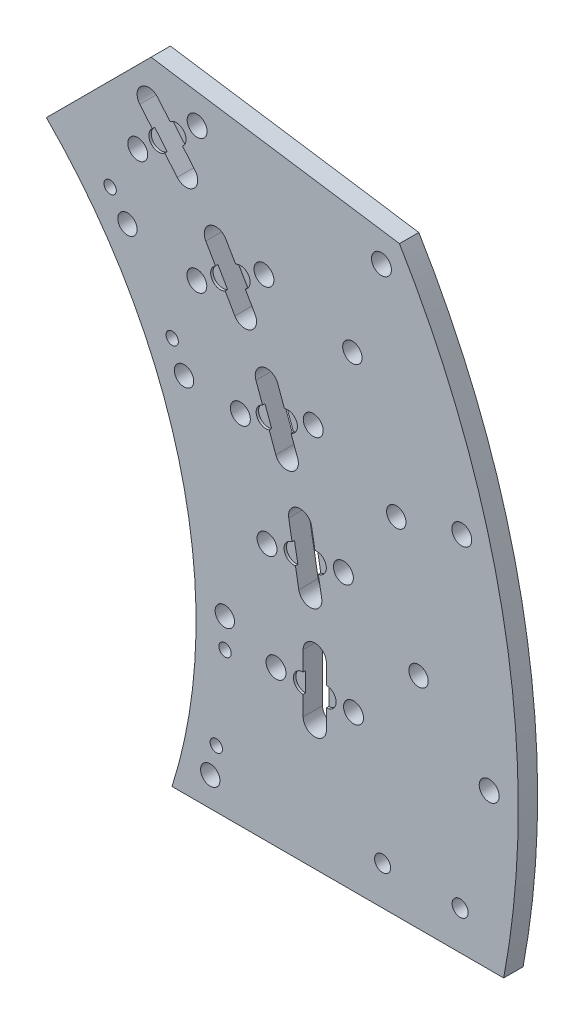
from build123d import *

# Parameters (mm, degrees)
SKETCH1_R           = 3.175
SKETCH1_R_2         = 2.0193
SKETCH1_R_3         = 3.2639
SKETCH1_R_4         = 2.6289
BOSS_EXTRUDE1_DEPTH = 6.35
SKETCH2_R           = 3.175
CUT_EXTRUDE1_DEPTH  = 0.79375


with BuildPart() as part:
    # Sketch1 → Boss-Extrude1 (new body)
    with BuildSketch(Plane.XY):
        with BuildLine():
            ThreePointArc((167.48125, 0), (165.496965553, -25.70454229), (159.591131024, -50.8))
            Line((159.591131024, -50.8), (268.282803213, -50.8))
            ThreePointArc((268.282803213, -50.8), (268.798556268, 47.996235774), (234.123018172, 140.508771477))
            Line((234.123018172, 140.508771477), (152.715190262, 152.715190262))
            Line((152.715190262, 152.715190262), (118.427127597, 118.427127597))
            ThreePointArc((118.427127597, 118.427127597), (154.732498954, 64.092299607), (167.48125, 0))
        make_face()
        with Locations((172.12665951, -41.275)):
            Circle(SKETCH1_R, mode=Mode.SUBTRACT)
        with Locations((174.097718528, -31.956172212)):
            Circle(SKETCH1_R_2, mode=Mode.SUBTRACT)
        with Locations((176.974598028, -3.347266353)):
            Circle(SKETCH1_R_2, mode=Mode.SUBTRACT)
        with Locations((193.675, 0)):
            Circle(SKETCH1_R_3, mode=Mode.SUBTRACT)
        with Locations((176.898422575, 6.177429038)):
            Circle(SKETCH1_R, mode=Mode.SUBTRACT)
        with Locations((190.732641565, 33.63131081)):
            Circle(SKETCH1_R_3, mode=Mode.SUBTRACT)
        with Locations((228.6, -38.1)):
            Circle(SKETCH1_R_4, mode=Mode.SUBTRACT)
        with BuildLine():
            Line((202.565, -9.525), (202.565, 0))
            Line((202.565, 0), (202.565, 9.525))
            ThreePointArc((202.565, 9.525), (206.375, 13.335), (210.185, 9.525))
            Line((210.185, 9.525), (210.185, 0))
            Line((210.185, 0), (210.185, -9.525))
            ThreePointArc((210.185, -9.525), (206.375, -13.335), (202.565, -9.525))
        make_face(mode=Mode.SUBTRACT)
        with Locations((219.075, 0)):
            Circle(SKETCH1_R_3, mode=Mode.SUBTRACT)
        with Locations((254, -38.1)):
            Circle(SKETCH1_R_4, mode=Mode.SUBTRACT)
        with Locations((263.525, 0)):
            Circle(SKETCH1_R_3, mode=Mode.SUBTRACT)
        with BuildLine():
            Line((201.141581381, 25.794749262), (199.487582489, 35.175043109))
            Line((199.487582489, 35.175043109), (197.833583597, 44.555336957))
            ThreePointArc((197.833583597, 44.555336957), (200.924101579, 48.969054052), (205.337818675, 45.87853607))
            Line((205.337818675, 45.87853607), (206.991817567, 36.498242223))
            Line((206.991817567, 36.498242223), (208.645816459, 27.117948375))
            ThreePointArc((208.645816459, 27.117948375), (205.555298477, 22.70423128), (201.141581381, 25.794749262))
        make_face(mode=Mode.SUBTRACT)
        with Locations((215.746758491, 38.041974522)):
            Circle(SKETCH1_R_3, mode=Mode.SUBTRACT)
        with Locations((240.38178065, 21.030680725)):
            Circle(SKETCH1_R, mode=Mode.SUBTRACT)
        with Locations((144.995031539, 101.526614087)):
            Circle(SKETCH1_R, mode=Mode.SUBTRACT)
        with Locations((163.532451502, 67.7373593)):
            Circle(SKETCH1_R, mode=Mode.SUBTRACT)
        with Locations((181.994968331, 66.240751259)):
            Circle(SKETCH1_R_3, mode=Mode.SUBTRACT)
        with BuildLine():
            Line((193.606577595, 60.33073812), (190.348835729, 69.281310333))
            Line((190.348835729, 69.281310333), (187.091093864, 78.231882546))
            ThreePointArc((187.091093864, 78.231882546), (189.368226003, 83.115208177), (194.251551635, 80.838076038))
            Line((194.251551635, 80.838076038), (197.5092935, 71.887503825))
            Line((197.5092935, 71.887503825), (200.767035365, 62.936931612))
            ThreePointArc((200.767035365, 62.936931612), (198.489903226, 58.053605981), (193.606577595, 60.33073812))
        make_face(mode=Mode.SUBTRACT)
        with Locations((159.651941396, 76.436052669)):
            Circle(SKETCH1_R_2, mode=Mode.SUBTRACT)
        with Locations((167.727470078, 96.8375)):
            Circle(SKETCH1_R_3, mode=Mode.SUBTRACT)
        with Locations((139.323763183, 109.179217581)):
            Circle(SKETCH1_R_2, mode=Mode.SUBTRACT)
        with Locations((148.363657521, 124.491890306)):
            Circle(SKETCH1_R_3, mode=Mode.SUBTRACT)
        with BuildLine():
            Line((180.188935918, 93.033608029), (175.426435918, 101.2825))
            Line((175.426435918, 101.2825), (170.663935918, 109.531391971))
            ThreePointArc((170.663935918, 109.531391971), (172.058492706, 114.735948759), (177.263049494, 113.341391971))
            Line((177.263049494, 113.341391971), (182.025549494, 105.0925))
            Line((182.025549494, 105.0925), (186.788049494, 96.843608029))
            ThreePointArc((186.788049494, 96.843608029), (185.393492706, 91.639051241), (180.188935918, 93.033608029))
        make_face(mode=Mode.SUBTRACT)
        with Locations((189.724515334, 109.5375)):
            Circle(SKETCH1_R_3, mode=Mode.SUBTRACT)
        with BuildLine():
            Line((161.296344603, 122.909698835), (155.17379262, 130.206272156))
            Line((155.17379262, 130.206272156), (149.051240638, 137.502845477))
            ThreePointArc((149.051240638, 137.502845477), (149.520849174, 142.870495598), (154.888499295, 142.400887063))
            Line((154.888499295, 142.400887063), (161.011051277, 135.104313742))
            Line((161.011051277, 135.104313742), (167.133603259, 127.807740421))
            ThreePointArc((167.133603259, 127.807740421), (166.663994724, 122.4400903), (161.296344603, 122.909698835))
        make_face(mode=Mode.SUBTRACT)
        with Locations((167.821186376, 140.818695592)):
            Circle(SKETCH1_R_3, mode=Mode.SUBTRACT)
        with Locations((205.863160899, 74.928062899)):
            Circle(SKETCH1_R_3, mode=Mode.SUBTRACT)
        with Locations((233.077901884, 62.453035583)):
            Circle(SKETCH1_R, mode=Mode.SUBTRACT)
        with Locations((254.545603373, 68.205288861)):
            Circle(SKETCH1_R_3, mode=Mode.SUBTRACT)
        with Locations((218.692069012, 101.977786558)):
            Circle(SKETCH1_R, mode=Mode.SUBTRACT)
        with Locations((228.219344532, 131.7625)):
            Circle(SKETCH1_R_3, mode=Mode.SUBTRACT)
    extrude(amount=BOSS_EXTRUDE1_DEPTH)

    # Sketch2 → Cut-Extrude1 (cut)
    with BuildSketch(Plane.XY.offset(6.35)):
        with Locations((202.565, 0)):
            Circle(SKETCH2_R)
        with Locations((210.185, 0)):
            Circle(SKETCH2_R)
        with Locations((199.487582489, 35.175043109)):
            Circle(SKETCH2_R)
        with Locations((206.991817567, 36.498242223)):
            Circle(SKETCH2_R)
        with Locations((190.348835729, 69.281310333)):
            Circle(SKETCH2_R)
        with Locations((197.5092935, 71.887503825)):
            Circle(SKETCH2_R)
        with Locations((175.426435918, 101.2825)):
            Circle(SKETCH2_R)
        with Locations((182.025549494, 105.0925)):
            Circle(SKETCH2_R)
        with Locations((155.17379262, 130.206272156)):
            Circle(SKETCH2_R)
        with Locations((161.011051277, 135.104313742)):
            Circle(SKETCH2_R)
    extrude(amount=-CUT_EXTRUDE1_DEPTH, mode=Mode.SUBTRACT)


solid = part.part
